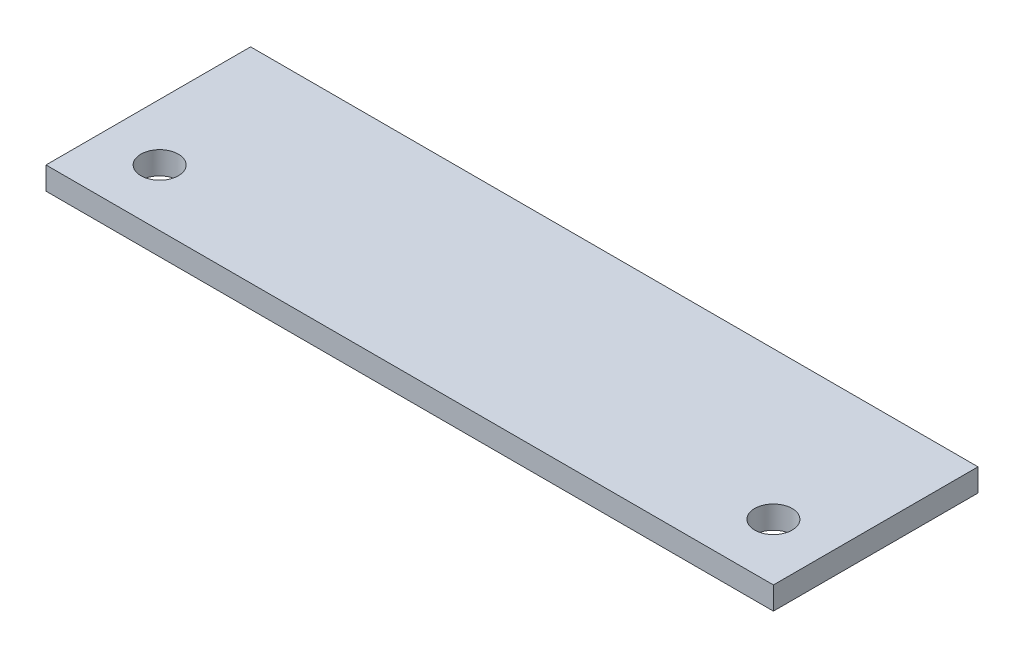
from build123d import *

# Parameters (mm, degrees)
SKETCH1_W           = 406.4
SKETCH1_H           = 114.3
BOSS_EXTRUDE1_DEPTH = 12.7
CUT_EXTRUDE1_REACH  = 424.359
SKETCH2_R           = 10.4775


with BuildPart() as part:
    # Sketch1 → Boss-Extrude1 (new body)
    with BuildSketch(Plane(origin=(0, 0, 0), x_dir=(1, 0, 0), z_dir=(0, 1, 0))):
        with Locations((203.2, 57.15)):
            Rectangle(SKETCH1_W, SKETCH1_H)
    extrude(amount=BOSS_EXTRUDE1_DEPTH)

    # Sketch2 → Cut-Extrude1 (cut, up to next)
    with BuildSketch(Plane(origin=(0, 12.7, 0), x_dir=(1, 0, 0), z_dir=(0, 1, 0)), mode=Mode.PRIVATE) as cut_extrude1_sk1:
        with Locations((31.75, 31.75)):
            Circle(SKETCH2_R)
    cut_extrude1_tool1 = extrude(cut_extrude1_sk1.sketch, amount=-CUT_EXTRUDE1_REACH, mode=Mode.PRIVATE) & part.part
    # Sketch2 → Cut-Extrude1 (cut, up to next)
    with BuildSketch(Plane(origin=(0, 12.7, 0), x_dir=(1, 0, 0), z_dir=(0, 1, 0)), mode=Mode.PRIVATE) as cut_extrude1_sk2:
        with Locations((374.65, 31.75)):
            Circle(SKETCH2_R)
    cut_extrude1_tool2 = extrude(cut_extrude1_sk2.sketch, amount=-CUT_EXTRUDE1_REACH, mode=Mode.PRIVATE) & part.part
    add(cut_extrude1_tool1.solids().sort_by_distance((31.75, 12.7, -31.75))[0], mode=Mode.SUBTRACT)
    add(cut_extrude1_tool2.solids().sort_by_distance((374.65, 12.7, -31.75))[0], mode=Mode.SUBTRACT)


solid = part.part
